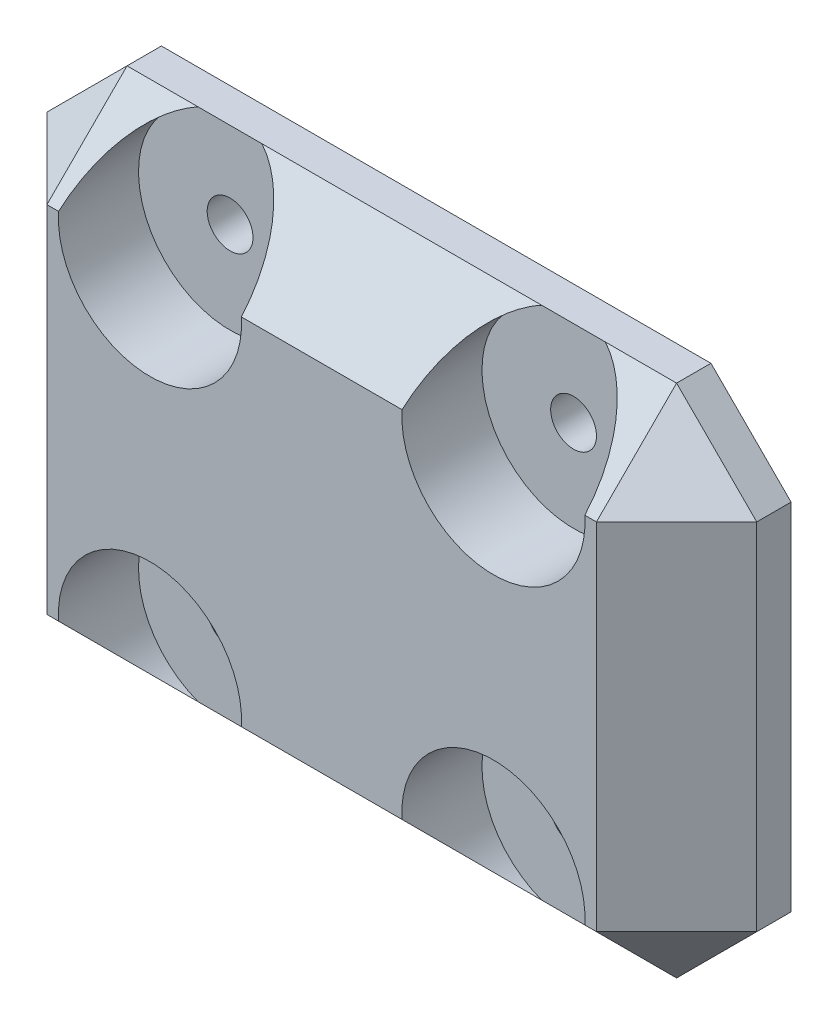
from build123d import *

# Parameters (mm, degrees)
SKETCH1_W           = 62
SKETCH1_H           = 45
SKETCH1_R           = 2
BOSS_EXTRUDE1_DEPTH = 10
SKETCH2_R           = 8
CUT_EXTRUDE1_DEPTH  = 7


with BuildPart() as part:
    # Sketch1 → Boss-Extrude1 (new body)
    with BuildSketch(Plane.XY):
        Rectangle(SKETCH1_W, SKETCH1_H)
        with Locations((-15, -15)):
            Circle(SKETCH1_R, mode=Mode.SUBTRACT)
        with Locations((-15, 15)):
            Circle(SKETCH1_R, mode=Mode.SUBTRACT)
        with Locations((15, 15)):
            Circle(SKETCH1_R, mode=Mode.SUBTRACT)
        with Locations((15, -15)):
            Circle(SKETCH1_R, mode=Mode.SUBTRACT)
    extrude(amount=BOSS_EXTRUDE1_DEPTH)

    # Chamfer1
    # the kernel refuses this chamfer: 7 mm, written as the material it takes off along each edge
    with BuildSketch(Plane(origin=(-26.333333333, 17.833333333, 5.333333333), x_dir=(0, 0.7071067811865476, -0.7071067811865476), z_dir=(-0.5773502691896257, 0.5773502691896257, 0.5773502691896257)), Plane(origin=(-26.333333333, -17.833333333, 5.333333333), x_dir=(0, 0.7071067811865476, 0.7071067811865476), z_dir=(-0.5773502691896257, -0.5773502691896257, 0.5773502691896257)), Plane(origin=(26.333333333, 17.833333333, 5.333333333), x_dir=(-0.7071067811865476, 0.7071067811865476, 0), z_dir=(0.5773502691896257, 0.5773502691896257, 0.5773502691896257))) as chamfer1_piece_1:
        Polygon((-4.949747468, -2.857738033), (4.949747468, -2.857738033), (0, 5.715476066), align=None)
    extrude(amount=8.891194146, mode=Mode.SUBTRACT)
    with BuildSketch(Plane(origin=(26.333333333, -17.833333333, 5.333333333), x_dir=(0, 0.7071067811865476, 0.7071067811865476), z_dir=(0.5773502691896257, -0.5773502691896257, 0.5773502691896257))) as chamfer1_piece_2:
        Polygon((-4.949747468, 2.857738033), (4.949747468, 2.857738033), (0, -5.715476066), align=None)
    extrude(amount=8.891194146, mode=Mode.SUBTRACT)
    with BuildSketch(Plane(origin=(-31, 40.501780916, 10), x_dir=(-0.02749587661058661, 0, -0.9996219169112968), z_dir=(0, -1, 0)), Plane(origin=(31, -40.501780916, 10), x_dir=(0.02749587661058661, 0, -0.9996219169112968), z_dir=(0, 1, 0))) as chamfer1_piece_3:
        with BuildLine():
            Line((7.200712366, 0), (-0.395830084, 7.189824555))
            Line((-0.395830084, 7.189824555), (-0.535777153, 7.185975132))
            ThreePointArc((-0.535777153, 7.185975132), (-0.238904589, 3.593784808), (-0.139947068, -0.003849423))
            Line((-0.139947068, -0.003849423), (0.003849423, -0.139947068))
            ThreePointArc((0.003849423, -0.139947068), (3.601483653, -0.040989547), (7.204561789, -0.139947068))
            Line((7.204561789, -0.139947068), (7.200712366, 0))
        make_face()
    extrude(amount=81.003561832, mode=Mode.SUBTRACT)
    with BuildSketch(Plane(origin=(-49.001780916, -22.5, 10), x_dir=(0, -0.02749587661058661, -0.9996219169112968), z_dir=(1, 0, 0)), Plane(origin=(49.001780916, 22.5, 10), x_dir=(0, 0.02749587661058661, -0.9996219169112968), z_dir=(-1, 0, 0))) as chamfer1_piece_4:
        with BuildLine():
            Line((7.200712366, 0), (-0.395830084, 7.189824555))
            Line((-0.395830084, 7.189824555), (-0.535777153, 7.185975132))
            ThreePointArc((-0.535777153, 7.185975132), (-0.238904589, 3.593784808), (-0.139947068, -0.003849423))
            Line((-0.139947068, -0.003849423), (0.003849423, -0.139947068))
            ThreePointArc((0.003849423, -0.139947068), (3.601483653, -0.040989547), (7.204561789, -0.139947068))
            Line((7.204561789, -0.139947068), (7.200712366, 0))
        make_face()
    extrude(amount=98.003561832, mode=Mode.SUBTRACT)
    with BuildSketch(Plane(origin=(31, -22.5, -18.001780916), x_dir=(-0.9996219169112968, -0.027495876610586605, 0), z_dir=(0, 0, 1)), Plane(origin=(-31, 22.5, -18.001780916), x_dir=(0.9996219169112968, 0.027495876610586605, 0), z_dir=(0, 0, 1)), Plane(origin=(31, 22.5, -18.001780916), x_dir=(0.02749587661058661, -0.9996219169112968, 0), z_dir=(0, 0, 1))) as chamfer1_piece_5:
        with BuildLine():
            Line((7.200712366, 0), (-0.395830084, -7.189824555))
            Line((-0.395830084, -7.189824555), (-0.535777153, -7.185975132))
            ThreePointArc((-0.535777153, -7.185975132), (-0.238904589, -3.593784808), (-0.139947068, 0.003849423))
            Line((-0.139947068, 0.003849423), (0.003849423, 0.139947068))
            ThreePointArc((0.003849423, 0.139947068), (3.601483653, 0.040989547), (7.204561789, 0.139947068))
            Line((7.204561789, 0.139947068), (7.200712366, 0))
        make_face()
    extrude(amount=46.003561832, mode=Mode.SUBTRACT)
    with BuildSketch(Plane(origin=(-31, -22.5, -18.001780916), x_dir=(0.9996219169112968, -0.027495876610586605, 0), z_dir=(0, 0, 1))) as chamfer1_piece_6:
        with BuildLine():
            Line((7.200712366, 0), (-0.395830084, 7.189824555))
            Line((-0.395830084, 7.189824555), (-0.535777153, 7.185975132))
            ThreePointArc((-0.535777153, 7.185975132), (-0.238904589, 3.593784808), (-0.139947068, -0.003849423))
            Line((-0.139947068, -0.003849423), (0.003849423, -0.139947068))
            ThreePointArc((0.003849423, -0.139947068), (3.601483653, -0.040989547), (7.204561789, -0.139947068))
            Line((7.204561789, -0.139947068), (7.200712366, 0))
        make_face()
    extrude(amount=46.003561832, mode=Mode.SUBTRACT)

    # Sketch2 → Cut-Extrude1 (cut)
    with BuildSketch(Plane.XY.offset(10)):
        with Locations((-15, 15)):
            Circle(SKETCH2_R)
        with Locations((-15, -15)):
            Circle(SKETCH2_R)
        with Locations((15, -15)):
            Circle(SKETCH2_R)
        with Locations((15, 15)):
            Circle(SKETCH2_R)
    extrude(amount=-CUT_EXTRUDE1_DEPTH, mode=Mode.SUBTRACT)


solid = part.part
